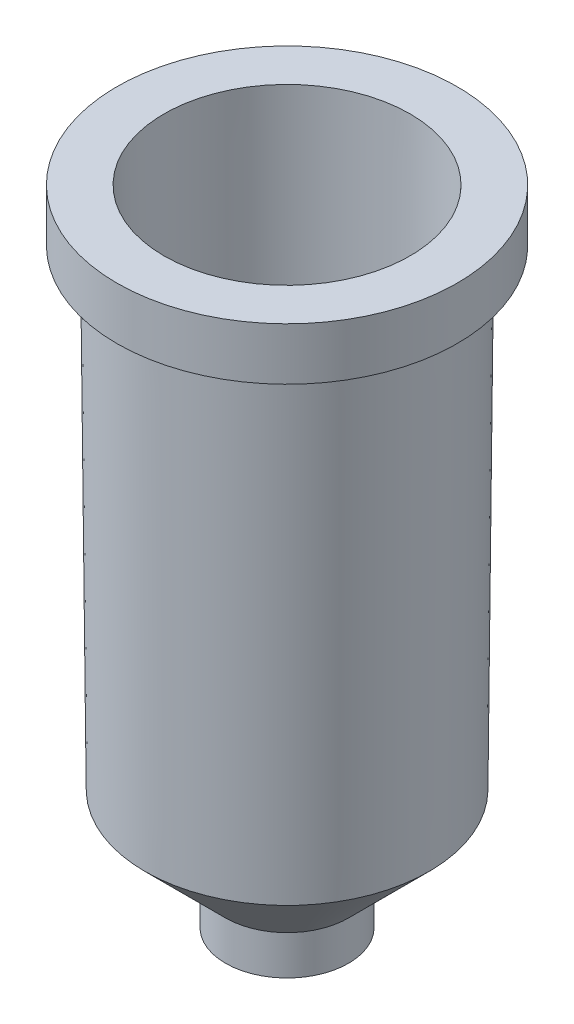
from build123d import *

# Parameters (mm, degrees)
SCALE1_SCALE = 0.856126482


with BuildPart() as part:
    # Sketch1 → Revolve25 (revolve)
    with BuildSketch(Plane.XY):
        Polygon((-4.7, 0), (-6.5, 0), (-6.5, -2), (-5.582580535, -2), (-5.425496915, -20), (-2.35, -23.075496915), (-2.35, -24.575496915), (-1.45, -24.575496915), (-1.45, -22.702704709), (-4.528744292, -19.623960417), align=None)
        Polygon((-5.59218009, -0.9), (-5.590434716, -1.1), (-5.6, -1.1), (-5.6, -0.9), align=None, mode=Mode.SUBTRACT)
    revolve(axis=Axis((0, 0, 0), (0, -1, 0)))


with BuildPart() as part_1:
    # Scale1: scaled about (0, -10.655280293, 0)
    add(part.part.scale(SCALE1_SCALE).moved(Location((0, -1.533012659, 0))))


solid = part_1.part
